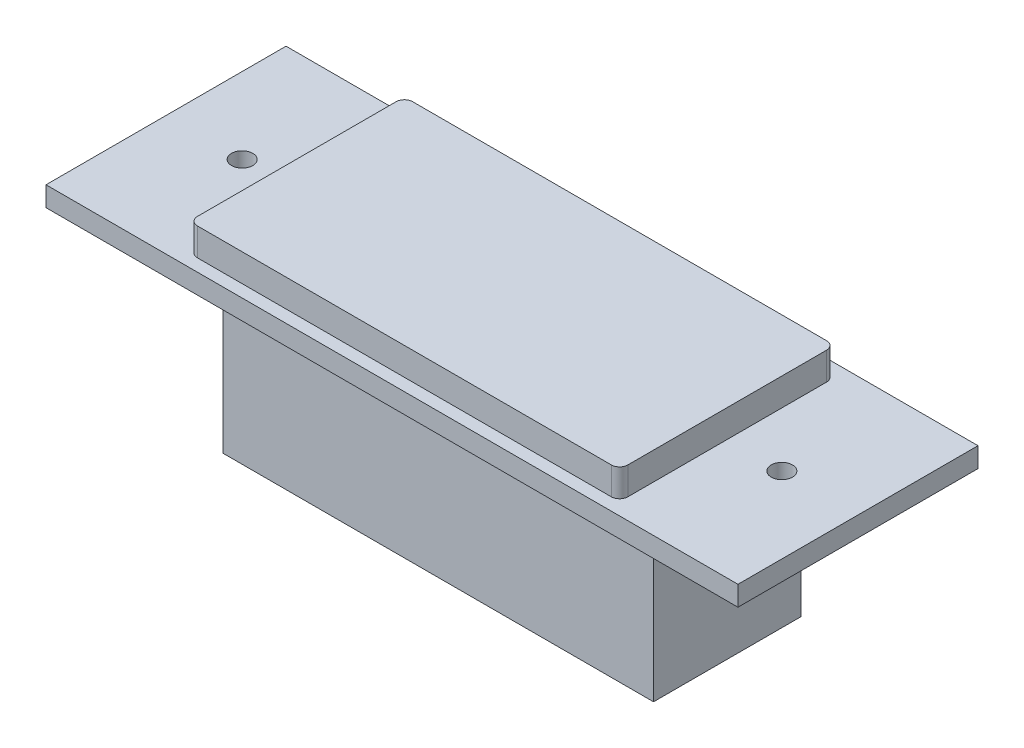
from build123d import *

# Parameters (mm, degrees)
SKETCH1_W             = 66.04
SKETCH1_H             = 33.02
BOSS_EXTRUDE1_DEPTH   = 4.2418
FILLET1_R             = 1.27
SKETCH2_W             = 106.172
SKETCH2_H             = 36.83
BOSS_EXTRUDE2_DEPTH   = 3.048
F_4_CLEARANCE_HOLE1_D = 3.2639
SKETCH6_W             = 66.04
SKETCH6_H             = 22.606
BOSS_EXTRUDE3_DEPTH   = 26.162


with BuildPart() as part:
    # Sketch1 → Boss-Extrude1 (new body)
    with BuildSketch(Plane(origin=(0, 0, 0), x_dir=(1, 0, 0), z_dir=(0, 1, 0))):
        Rectangle(SKETCH1_W, SKETCH1_H)
    extrude(amount=BOSS_EXTRUDE1_DEPTH)

    # Fillet1
    fillet1_edges = [part.edges().sort_by_distance(p)[0] for p in [
        (33.02, 2.1209, 16.51),
        (33.02, 2.1209, -16.51),
        (-33.02, 2.1209, -16.51),
        (-33.02, 2.1209, 16.51),
    ]]
    fillet(fillet1_edges, radius=FILLET1_R)

    # Sketch2 → Boss-Extrude2 (add)
    with BuildSketch(Plane.XZ):
        Rectangle(SKETCH2_W, SKETCH2_H)
    extrude(amount=BOSS_EXTRUDE2_DEPTH)

    # #4 Clearance Hole1 (through all)
    with Locations(Plane(origin=(0, 0, 0), x_dir=(1, 0, 0), z_dir=(0, 1, 0))):
        with Locations((-41.402, 0), (41.402, 0)):
            Hole(F_4_CLEARANCE_HOLE1_D / 2)

    # Sketch6 → Boss-Extrude3 (add)
    with BuildSketch(Plane.XZ.offset(3.048)):
        Rectangle(SKETCH6_W, SKETCH6_H)
    extrude(amount=BOSS_EXTRUDE3_DEPTH)


solid = part.part
